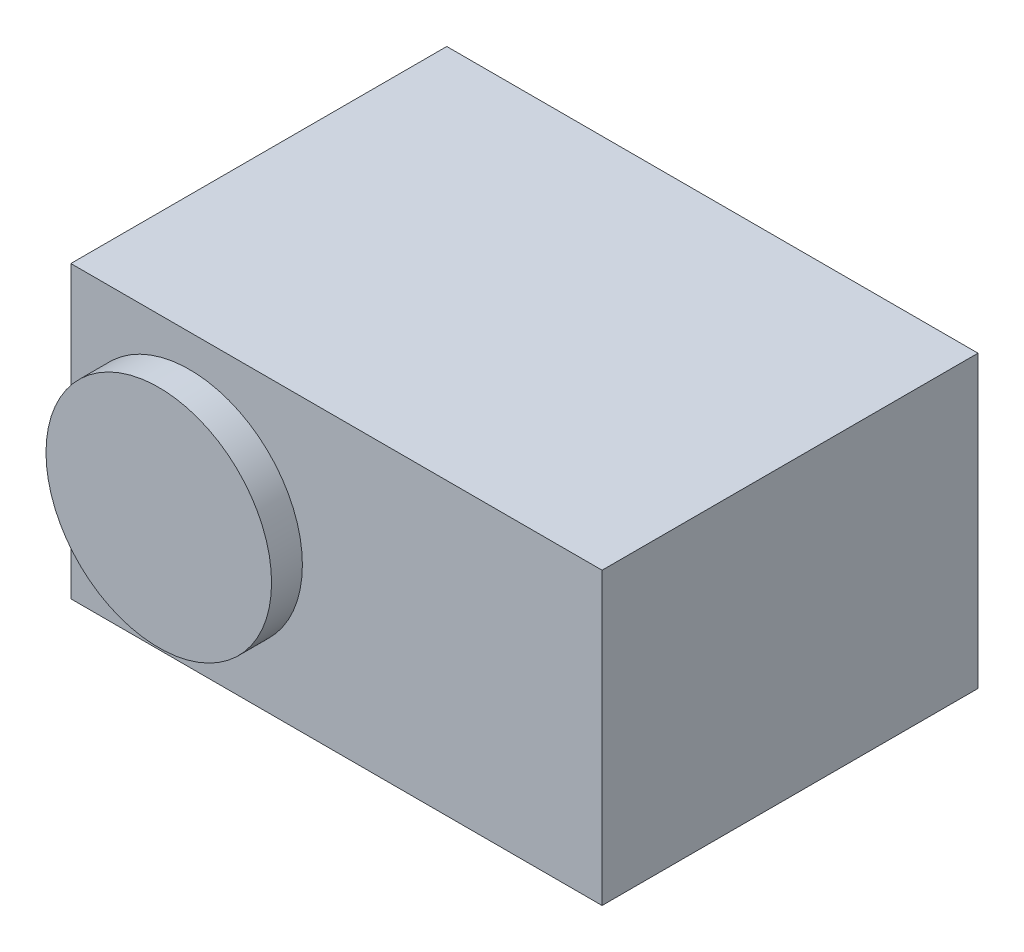
from build123d import *

# Parameters (mm, degrees)
S_BOX1_W     = 45.22
S_BOX1_H     = 24.72
BOSS_1_DEPTH = 32
S_CYL2_R     = 9.6
BOSS_2_DEPTH = 3.125
S_CYL3_R     = 9.6
BOSS_3_DEPTH = 3.125
S_HOLE4_R    = 1.35
HOLE_4_DEPTH = 1.1
S_HOLE5_R    = 1.35
HOLE_5_DEPTH = 1.1
S_HOLE6_R    = 1.35
HOLE_6_DEPTH = 1.1
S_HOLE7_R    = 1.35
HOLE_7_DEPTH = 1.1


with BuildPart() as part:
    # S_box1 → Boss_1 (new body)
    with BuildSketch(Plane.XY.offset(-16)):
        with Locations((12.5, 0)):
            Rectangle(S_BOX1_W, S_BOX1_H)
    extrude(amount=BOSS_1_DEPTH)

    # S_cyl2 → Boss_2 (add)
    with BuildSketch(Plane.XY.offset(15.5)):
        Circle(S_CYL2_R)
    extrude(amount=BOSS_2_DEPTH)

    # S_cyl3 → Boss_3 (add)
    with BuildSketch(Plane.XY.offset(-18.625)):
        Circle(S_CYL3_R)
    extrude(amount=BOSS_3_DEPTH)

    # S_hole4 → Hole_4 (cut)
    with BuildSketch(Plane.XY.offset(17.625)):
        with Locations((4.949747468, 4.949747468)):
            Circle(S_HOLE4_R)
    extrude(amount=-HOLE_4_DEPTH, mode=Mode.SUBTRACT)

    # S_hole5 → Hole_5 (cut)
    with BuildSketch(Plane.XY.offset(17.625)):
        with Locations((-4.949747468, 4.949747468)):
            Circle(S_HOLE5_R)
    extrude(amount=-HOLE_5_DEPTH, mode=Mode.SUBTRACT)

    # S_hole6 → Hole_6 (cut)
    with BuildSketch(Plane.XY.offset(17.625)):
        with Locations((-4.949747468, -4.949747468)):
            Circle(S_HOLE6_R)
    extrude(amount=-HOLE_6_DEPTH, mode=Mode.SUBTRACT)

    # S_hole7 → Hole_7 (cut)
    with BuildSketch(Plane.XY.offset(17.625)):
        with Locations((4.949747468, -4.949747468)):
            Circle(S_HOLE7_R)
    extrude(amount=-HOLE_7_DEPTH, mode=Mode.SUBTRACT)


solid = part.part
